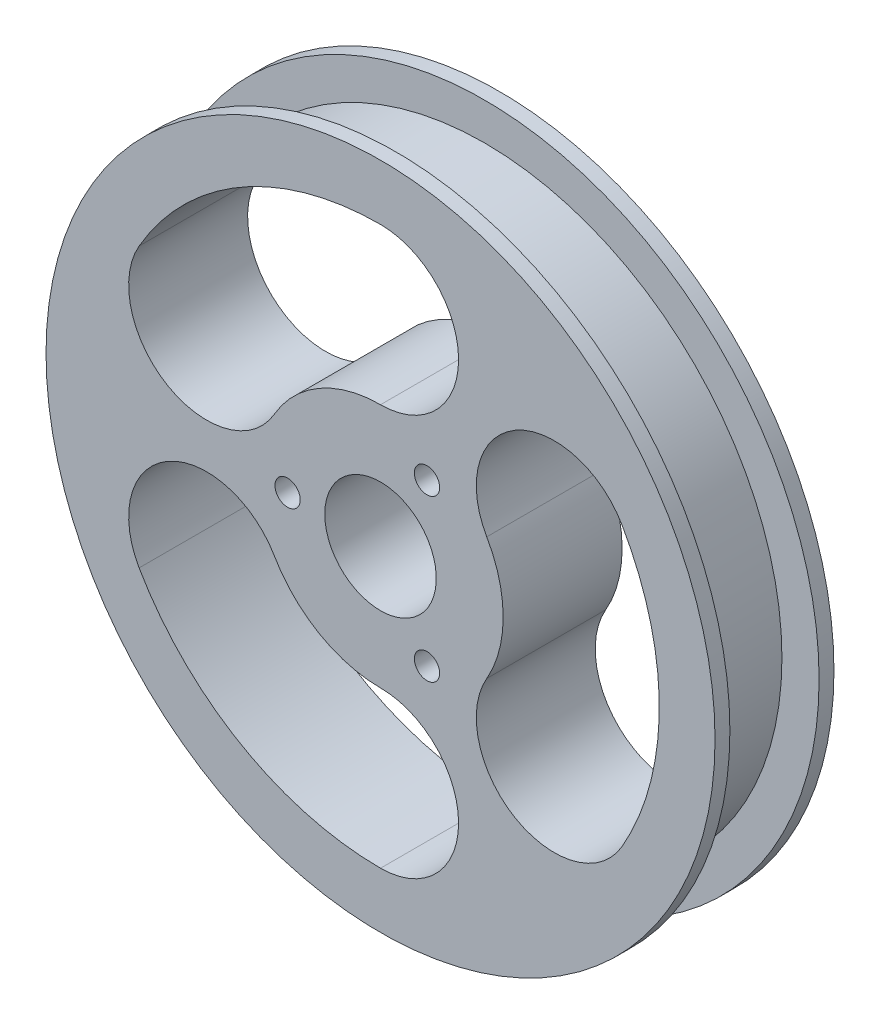
from build123d import *

# Parameters (mm, degrees)
SKETCH_1_R          = 40
EXTRUDE_1_DEPTH     = 12
SKETCH_8_R          = 45
EXTRUDE_3_DEPTH     = 2
EXTRUDE_START       = 2
SKETCH_21_R         = 45
EXTRUDE_4_DEPTH     = 2
SKETCH_2_R          = 7.5
CUT_EXTRUDE_1_DEPTH = 66.620118866
HOLE_WIZARD_M32_D   = 3.4
CUT_EXTRUDE_2_DEPTH = 66.620118866


with BuildPart() as part:
    # Эскиз1 → Бобышка-Вытянуть1 (new body)
    with BuildSketch(Plane.XY):
        Circle(SKETCH_1_R)
    extrude(amount=EXTRUDE_1_DEPTH)

    # Эскиз8 → Бобышка-Вытянуть3 (add)
    with BuildSketch(Plane.XY.offset(12)):
        Circle(SKETCH_8_R)
    extrude(amount=EXTRUDE_3_DEPTH)

    # Эскиз21 → Бобышка-Вытянуть4 (add)
    with BuildSketch(Plane(origin=(0, 0, 0), x_dir=(-1, 0, 0), z_dir=(0, 0, -1)).offset(EXTRUDE_START)):
        Circle(SKETCH_21_R)
    extrude(amount=-EXTRUDE_4_DEPTH)

    # Эскиз2 → Вырез-Вытянуть1 (cut, through all)
    with BuildSketch(Plane(origin=(0, 0, 14), x_dir=(-1, 0, 0), z_dir=(0, 0, -1))):
        Circle(SKETCH_2_R)
    extrude(amount=CUT_EXTRUDE_1_DEPTH, mode=Mode.SUBTRACT)

    # Отверстие с зазором M32 (through all)
    with Locations(Plane.XY.offset(14)):
        with Locations((6.25, 10.825317547), (-12.5, 0), (6.25, -10.825317547)):
            Hole(HOLE_WIZARD_M32_D / 2)

    # Эскиз10 → Вырез-Вытянуть2 (cut, through all)
    with BuildSketch(Plane(origin=(0, 0, 14), x_dir=(-1, 0, 0), z_dir=(0, 0, -1))):
        with BuildLine():
            ThreePointArc((32.475952642, -18.75), (28.632685902, -4.40673326), (14.289419162, -8.25))
            ThreePointArc((14.289419162, -8.25), (8.25, -14.289419162), (0, -16.5))
            ThreePointArc((0, -16.5), (-10.5, -27), (0, -37.5))
            ThreePointArc((0, -37.5), (18.75, -32.475952642), (32.475952642, -18.75))
        make_face()
        with BuildLine():
            ThreePointArc((32.475952642, 18.75), (18.75, 32.475952642), (0, 37.5))
            ThreePointArc((0, 37.5), (-10.5, 27), (0, 16.5))
            ThreePointArc((0, 16.5), (8.25, 14.289419162), (14.289419162, 8.25))
            ThreePointArc((14.289419162, 8.25), (28.632685902, 4.40673326), (32.475952642, 18.75))
        make_face()
        with BuildLine():
            ThreePointArc((-32.475952642, -18.75), (-18.132685902, -22.59326674), (-14.289419162, -8.25))
            ThreePointArc((-14.289419162, -8.25), (-16.5, 0), (-14.289419162, 8.25))
            ThreePointArc((-14.289419162, 8.25), (-18.132685902, 22.59326674), (-32.475952642, 18.75))
            ThreePointArc((-32.475952642, 18.75), (-37.5, 0), (-32.475952642, -18.75))
        make_face()
    extrude(amount=CUT_EXTRUDE_2_DEPTH, mode=Mode.SUBTRACT)


solid = part.part
